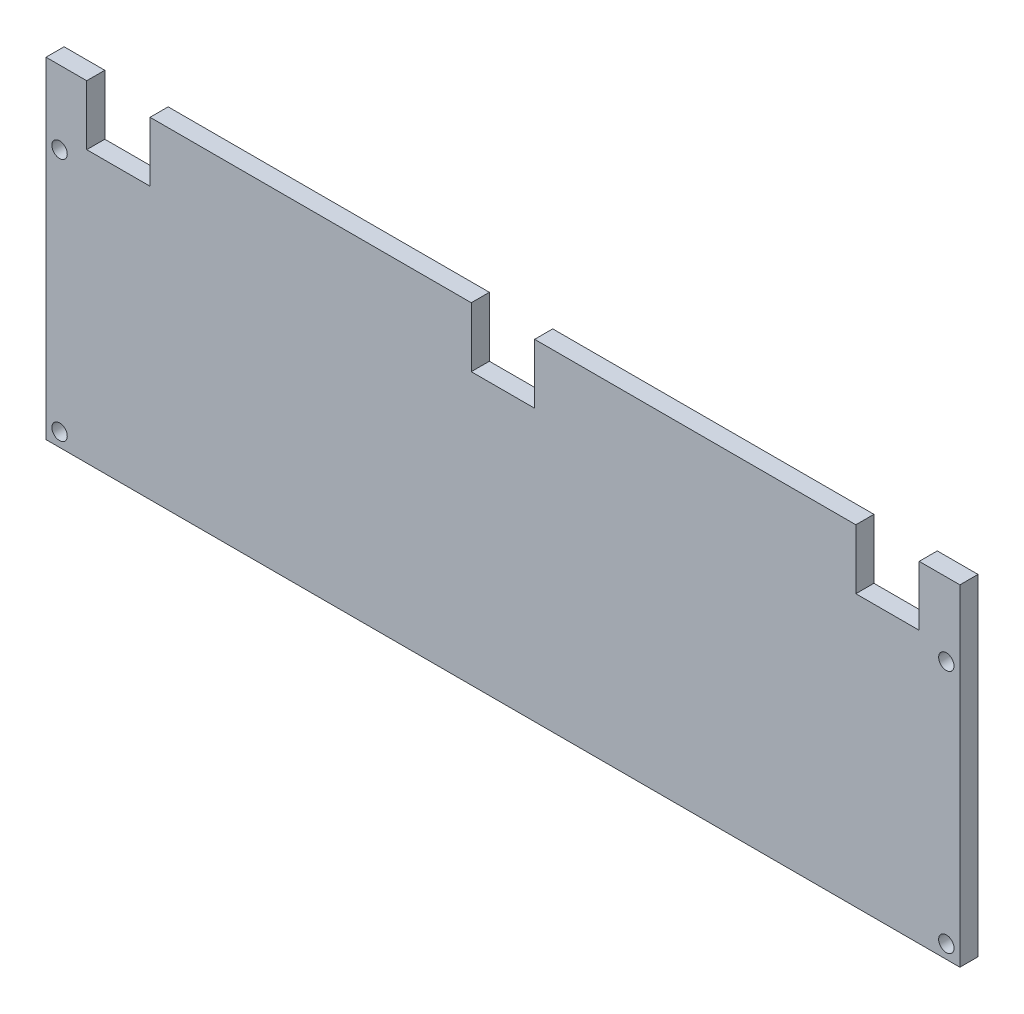
from build123d import *

# Parameters (mm, degrees)
IZIM1_W               = 505
IZIM1_H               = 150
TABAN_FLAN_1_DEPTH    = 10
IZIM2_R               = 4.25
KES_EKSTR_ZYON1_DEPTH = 10
IZIM3_W               = 22.5
IZIM3_H               = 33
IZIM3_W_2             = 177.5
SEKME1_DEPTH          = 10


# Sheet-metal steps are written as plain solids
with BuildPart() as part:
    # Çizim1 → Taban-Flanş1 (new body)
    with BuildSketch(Plane.XY):
        Rectangle(IZIM1_W, IZIM1_H)
    extrude(amount=-TABAN_FLAN_1_DEPTH)

    # Çizim2 → Kes-Ekstrüzyon1 (cut)
    with BuildSketch(Plane.XY):
        with Locations((-245, 67.5)):
            Circle(IZIM2_R)
        with Locations(Location((245, 67.5, 0), (0, 0, 180))):
            Circle(IZIM2_R)
    kes_ekstr_zyon1 = extrude(amount=-KES_EKSTR_ZYON1_DEPTH, mode=Mode.SUBTRACT)

    # Aynalama1: Kes-Ekstrüzyon1 across plane
    add(kes_ekstr_zyon1.mirror(Plane.ZX), mode=Mode.SUBTRACT)

    # Çizim3 → Sekme1 (add)
    with BuildSketch(Plane.XY):
        with Locations((241.25, 91.5)):
            Rectangle(IZIM3_W, IZIM3_H)
        with Locations((106.25, 91.5)):
            Rectangle(IZIM3_W_2, IZIM3_H)
        with Locations((-106.25, 91.5)):
            Rectangle(IZIM3_W_2, IZIM3_H)
        with Locations((-241.25, 91.5)):
            Rectangle(IZIM3_W, IZIM3_H)
    extrude(amount=-SEKME1_DEPTH)


solid = part.part
